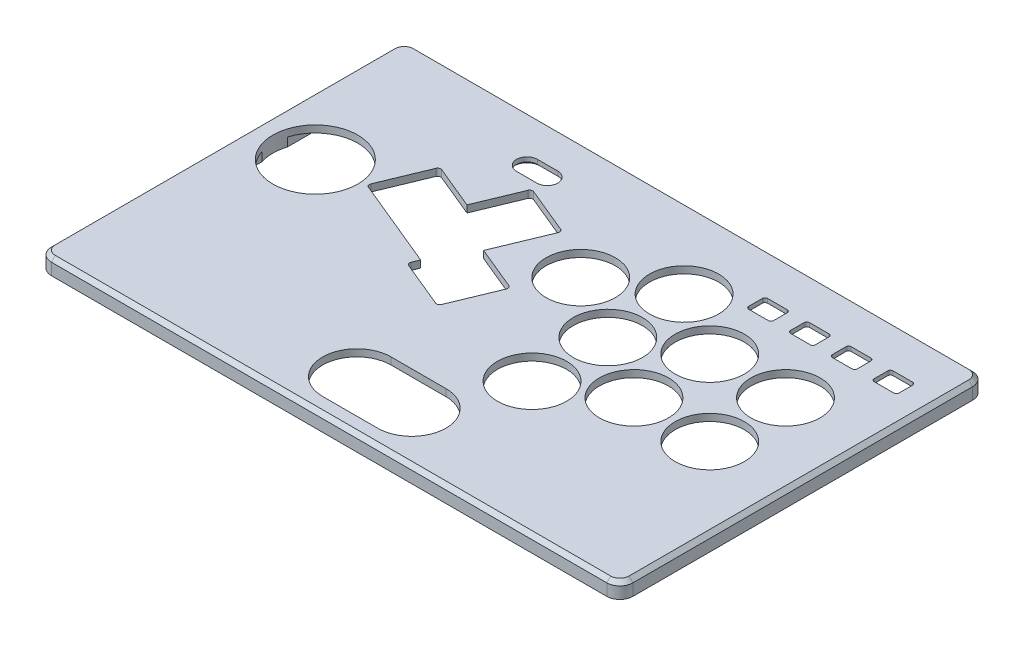
from build123d import *

# Parameters (mm, degrees)
SKETCH1_W                = 222.53
SKETCH1_H                = 140
TOP_PLATE_DEPTH          = 6
CORNER_FILLET_R          = 5
M3_CLEARANCE_HOLE1_D     = 3.4
M3_CLEARANCE_HOLE1_DEPTH = 4.228536948
M3_CLEARANCE_HOLE1_TIP   = 1.021463052
SKETCH4_R                = 16.25
SKETCH4_R_2              = 13.25
PRIMARY_BUTTONS_DEPTH    = 10
EXTRA_BUTTONS_REACH      = 264.975
SKETCH8_W                = 207.53
SKETCH8_H                = 125
HOLLOW_OUT_DEPTH         = 3.3
FILLET1_R                = 10
FILLET2_R                = 5
SKETCH15_W               = 64
SKETCH15_H               = 16
CUT_EXTRUDE4_DEPTH       = 4.4
LIGHT_GUIDE_CUTOUT_DEPTH = 10
CHAMFER1_SIZE            = 1
TOP_CHAMFER_SIZE         = 1.5
NUT_START                = -1.2
NUT_CUTOUT_DEPTH         = 2


with BuildPart() as part:
    # Sketch1 → Top Plate (new body)
    with BuildSketch(Plane(origin=(0, 0, 0), x_dir=(1, 0, 0), z_dir=(0, 1, 0))):
        with Locations((111.265, 70)):
            Rectangle(SKETCH1_W, SKETCH1_H)
    extrude(amount=TOP_PLATE_DEPTH)

    # Corner Fillet
    corner_fillet_edges = [part.edges().sort_by_distance(p)[0] for p in [
        (0, 3, -140),
        (0, 3, 0),
        (222.53, 3, -140),
        (222.53, 3, 0),
    ]]
    fillet(corner_fillet_edges, radius=CORNER_FILLET_R)

    # M3 Clearance Hole1
    with Locations(Plane(origin=(217.03, 0, -5.5), x_dir=(0, 0, -1), z_dir=(0, -1, 0))):
        with Locations((0, 0), (129, 0), (129, -211.53), (0, -211.53)):
            Hole(M3_CLEARANCE_HOLE1_D / 2, depth=M3_CLEARANCE_HOLE1_DEPTH)
            with Locations((0, 0, -(M3_CLEARANCE_HOLE1_DEPTH + M3_CLEARANCE_HOLE1_TIP / 2))):  # 118° drill point
                Cone(0, M3_CLEARANCE_HOLE1_D / 2, M3_CLEARANCE_HOLE1_TIP, mode=Mode.SUBTRACT)

    # Sketch4 → Primary Buttons (cut)
    with BuildSketch(Plane(origin=(0, 6, 0), x_dir=(-1, 0, 0), z_dir=(0, -1, 0))):
        with BuildLine():
            Line((-76.421789326, 69.891190568), (-42.330634918, 84.01220868))
            ThreePointArc((-42.330634918, 84.01220868), (-41.681199598, 84.661644), (-41.681199598, 85.580084238))
            Line((-41.681199598, 85.580084238), (-48.971318984, 103.179989332))
            ThreePointArc((-48.971318984, 103.179989332), (-49.620754304, 103.829424652), (-50.539194542, 103.829424652))
            Line((-50.539194542, 103.829424652), (-67.030443813, 96.998525544))
            Line((-67.030443813, 96.998525544), (-73.861342517, 113.489775595))
            ThreePointArc((-73.861342517, 113.489775595), (-74.510777833, 114.139210949), (-75.429218092, 114.139210957))
            Line((-75.429218092, 114.139210957), (-93.029123186, 106.849091571))
            ThreePointArc((-93.029123186, 106.849091571), (-93.678558502, 106.199656261), (-93.678558515, 105.281216033))
            Line((-93.678558515, 105.281216033), (-86.388439374, 87.681310625))
            Line((-86.388439374, 87.681310625), (-85.316925644, 85.094447645))
            Line((-85.316925644, 85.094447645), (-101.80817536, 78.263548352))
            ThreePointArc((-101.80817536, 78.263548352), (-102.457610681, 77.614113031), (-102.457610681, 76.695672794))
            Line((-102.457610681, 76.695672794), (-95.167491294, 59.095767699))
            ThreePointArc((-95.167491294, 59.095767699), (-94.518055974, 58.446332379), (-93.599615736, 58.446332379))
            Line((-93.599615736, 58.446332379), (-75.999710782, 65.736451708))
            ThreePointArc((-75.999710782, 65.736451708), (-75.350275462, 66.385887028), (-75.350275462, 67.304327265))
            Line((-75.350275462, 67.304327265), (-76.421789326, 69.891190568))
        make_face()
        with BuildLine():
            Line((-102.903943224, 32.099999517), (-123.903943224, 32.099999517))
            ThreePointArc((-123.903943224, 32.099999517), (-137.003943224, 18.999999517), (-123.903943224, 5.899999517))
            Line((-123.903943224, 5.899999517), (-102.903943224, 5.899999517))
            ThreePointArc((-102.903943224, 5.899999517), (-89.803943224, 18.999999517), (-102.903943224, 32.099999517))
        make_face()
        with Locations((-23, 83.008304)):
            Circle(SKETCH4_R)
        with Locations((-137.933943, 51)):
            Circle(SKETCH4_R_2)
        with Locations((-162.933943, 65)):
            Circle(SKETCH4_R_2)
        with Locations((-191.933943, 65)):
            Circle(SKETCH4_R_2)
        with Locations((-191.933943, 94)):
            Circle(SKETCH4_R_2)
        with Locations((-162.933943, 94)):
            Circle(SKETCH4_R_2)
        with Locations((-137.933943, 80)):
            Circle(SKETCH4_R_2)
        with Locations((-138.114257, 108.999439)):
            Circle(SKETCH4_R_2)
        with Locations((-112.915906, 94.645876)):
            Circle(SKETCH4_R_2)
    extrude(amount=PRIMARY_BUTTONS_DEPTH, mode=Mode.SUBTRACT)

    # Sketch5 → Extra Buttons (cut, up to next)
    with BuildSketch(Plane.XZ, mode=Mode.PRIVATE) as extra_buttons_sk1:
        with BuildLine():
            Line((154.55, -122.52), (154.55, -117.32))
            ThreePointArc((154.55, -117.32), (154.842893219, -116.612893219), (155.55, -116.32))
            Line((155.55, -116.32), (163.05, -116.32))
            ThreePointArc((163.05, -116.32), (163.757106781, -116.612893219), (164.05, -117.32))
            Line((164.05, -117.32), (164.05, -122.52))
            ThreePointArc((164.05, -122.52), (163.757106781, -123.227106781), (163.05, -123.52))
            Line((163.05, -123.52), (155.55, -123.52))
            ThreePointArc((155.55, -123.52), (154.842893219, -123.227106781), (154.55, -122.52))
        make_face()
    extra_buttons_tool1 = extrude(extra_buttons_sk1.sketch, amount=-EXTRA_BUTTONS_REACH, mode=Mode.PRIVATE) & part.part
    # Sketch5 → Extra Buttons (cut, up to next)
    with BuildSketch(Plane.XZ, mode=Mode.PRIVATE) as extra_buttons_sk2:
        with BuildLine():
            Line((170.55, -122.52), (170.55, -117.32))
            ThreePointArc((170.55, -117.32), (170.842893219, -116.612893219), (171.55, -116.32))
            Line((171.55, -116.32), (179.05, -116.32))
            ThreePointArc((179.05, -116.32), (179.757106781, -116.612893219), (180.05, -117.32))
            Line((180.05, -117.32), (180.05, -122.52))
            ThreePointArc((180.05, -122.52), (179.757106781, -123.227106781), (179.05, -123.52))
            Line((179.05, -123.52), (171.55, -123.52))
            ThreePointArc((171.55, -123.52), (170.842893219, -123.227106781), (170.55, -122.52))
        make_face()
    extra_buttons_tool2 = extrude(extra_buttons_sk2.sketch, amount=-EXTRA_BUTTONS_REACH, mode=Mode.PRIVATE) & part.part
    # Sketch5 → Extra Buttons (cut, up to next)
    with BuildSketch(Plane.XZ, mode=Mode.PRIVATE) as extra_buttons_sk3:
        with BuildLine():
            Line((186.55, -122.52), (186.55, -117.32))
            ThreePointArc((186.55, -117.32), (186.842893219, -116.612893219), (187.55, -116.32))
            Line((187.55, -116.32), (195.05, -116.32))
            ThreePointArc((195.05, -116.32), (195.757106781, -116.612893219), (196.05, -117.32))
            Line((196.05, -117.32), (196.05, -122.52))
            ThreePointArc((196.05, -122.52), (195.757106781, -123.227106781), (195.05, -123.52))
            Line((195.05, -123.52), (187.55, -123.52))
            ThreePointArc((187.55, -123.52), (186.842893219, -123.227106781), (186.55, -122.52))
        make_face()
    extra_buttons_tool3 = extrude(extra_buttons_sk3.sketch, amount=-EXTRA_BUTTONS_REACH, mode=Mode.PRIVATE) & part.part
    # Sketch5 → Extra Buttons (cut, up to next)
    with BuildSketch(Plane.XZ, mode=Mode.PRIVATE) as extra_buttons_sk4:
        with BuildLine():
            Line((202.55, -122.52), (202.55, -117.32))
            ThreePointArc((202.55, -117.32), (202.842893219, -116.612893219), (203.55, -116.32))
            Line((203.55, -116.32), (211.05, -116.32))
            ThreePointArc((211.05, -116.32), (211.757106781, -116.612893219), (212.05, -117.32))
            Line((212.05, -117.32), (212.05, -122.52))
            ThreePointArc((212.05, -122.52), (211.757106781, -123.227106781), (211.05, -123.52))
            Line((211.05, -123.52), (203.55, -123.52))
            ThreePointArc((203.55, -123.52), (202.842893219, -123.227106781), (202.55, -122.52))
        make_face()
    extra_buttons_tool4 = extrude(extra_buttons_sk4.sketch, amount=-EXTRA_BUTTONS_REACH, mode=Mode.PRIVATE) & part.part
    add(extra_buttons_tool1.solids().sort_by_distance((159.3, 0, -119.92))[0], mode=Mode.SUBTRACT)
    add(extra_buttons_tool2.solids().sort_by_distance((175.3, 0, -119.92))[0], mode=Mode.SUBTRACT)
    add(extra_buttons_tool3.solids().sort_by_distance((191.3, 0, -119.92))[0], mode=Mode.SUBTRACT)
    add(extra_buttons_tool4.solids().sort_by_distance((207.3, 0, -119.92))[0], mode=Mode.SUBTRACT)

    # Sketch8 → Hollow Out (cut)
    with BuildSketch(Plane.XZ):
        with Locations((111.265, -70)):
            Rectangle(SKETCH8_W, SKETCH8_H)
    extrude(amount=-HOLLOW_OUT_DEPTH, mode=Mode.SUBTRACT)

    # Fillet1
    fillet1_edges = [part.edges().sort_by_distance(p)[0] for p in [
        (7.5, 1.65, -132.5),
        (7.5, 1.65, -7.5),
        (215.03, 1.65, -7.5),
    ]]
    fillet(fillet1_edges, radius=FILLET1_R)

    # Fillet2
    fillet2_edges = [part.edges().sort_by_distance(p)[0] for p in [
        (215.03, 1.65, -132.5),
    ]]
    fillet(fillet2_edges, radius=FILLET2_R)

    # Sketch15 → Cut-Extrude4 (cut)
    with BuildSketch(Plane.XZ):
        with Locations((183.3, -119.92)):
            Rectangle(SKETCH15_W, SKETCH15_H)
    extrude(amount=-CUT_EXTRUDE4_DEPTH, mode=Mode.SUBTRACT)

    # Sketch9 → Light Guide Cutout (cut)
    with BuildSketch(Plane(origin=(0, 6, 0), x_dir=(1, 0, 0), z_dir=(0, 1, 0))):
        with BuildLine():
            Line((65.42, 125.5875), (73.19, 125.5875))
            ThreePointArc((73.19, 125.5875), (77.19, 121.5875), (73.19, 117.5875))
            Line((73.19, 117.5875), (65.42, 117.5875))
            ThreePointArc((65.42, 117.5875), (61.42, 121.5875), (65.42, 125.5875))
        make_face()
    extrude(amount=-LIGHT_GUIDE_CUTOUT_DEPTH, mode=Mode.SUBTRACT)

    # Chamfer1
    chamfer1_edges = [part.edges().sort_by_distance(p)[0] for p in [
        (77.19, 3.3, -121.5875),
        (69.305, 3.3, -117.5875),
        (61.42, 3.3, -121.5875),
        (69.305, 3.3, -125.5875),
    ]]
    chamfer(chamfer1_edges, length=CHAMFER1_SIZE)

    # Top Chamfer
    top_chamfer_edges = [part.edges().sort_by_distance(p)[0] for p in [
        (221.065533906, 6, -138.535533906),
        (222.53, 6, -70),
        (221.065533906, 6, -1.464466094),
        (111.265, 6, -140),
        (1.464466094, 6, -138.535533906),
        (0, 6, -70),
        (1.464466094, 6, -1.464466094),
        (111.265, 6, 0),
    ]]
    chamfer(top_chamfer_edges, length=TOP_CHAMFER_SIZE)

    # Sketch11 → Nut Cutout (cut)
    with BuildSketch(Plane.XZ.offset(NUT_START)):
        Polygon((217.03, -138.601219331), (212.928780669, -134.5), (217.03, -130.398780669), (221.131219331, -134.5), align=None)
        Polygon((1.398780669, -134.5), (5.5, -130.398780669), (9.601219331, -134.5), (5.5, -138.601219331), align=None)
        Polygon((5.5, -9.601219331), (1.398780669, -5.5), (5.5, -1.398780669), (9.601219331, -5.5), align=None)
        Polygon((217.03, -9.601219331), (212.928780669, -5.5), (217.03, -1.398780669), (221.131219331, -5.5), align=None)
    extrude(amount=-NUT_CUTOUT_DEPTH, mode=Mode.SUBTRACT)


solid = part.part
